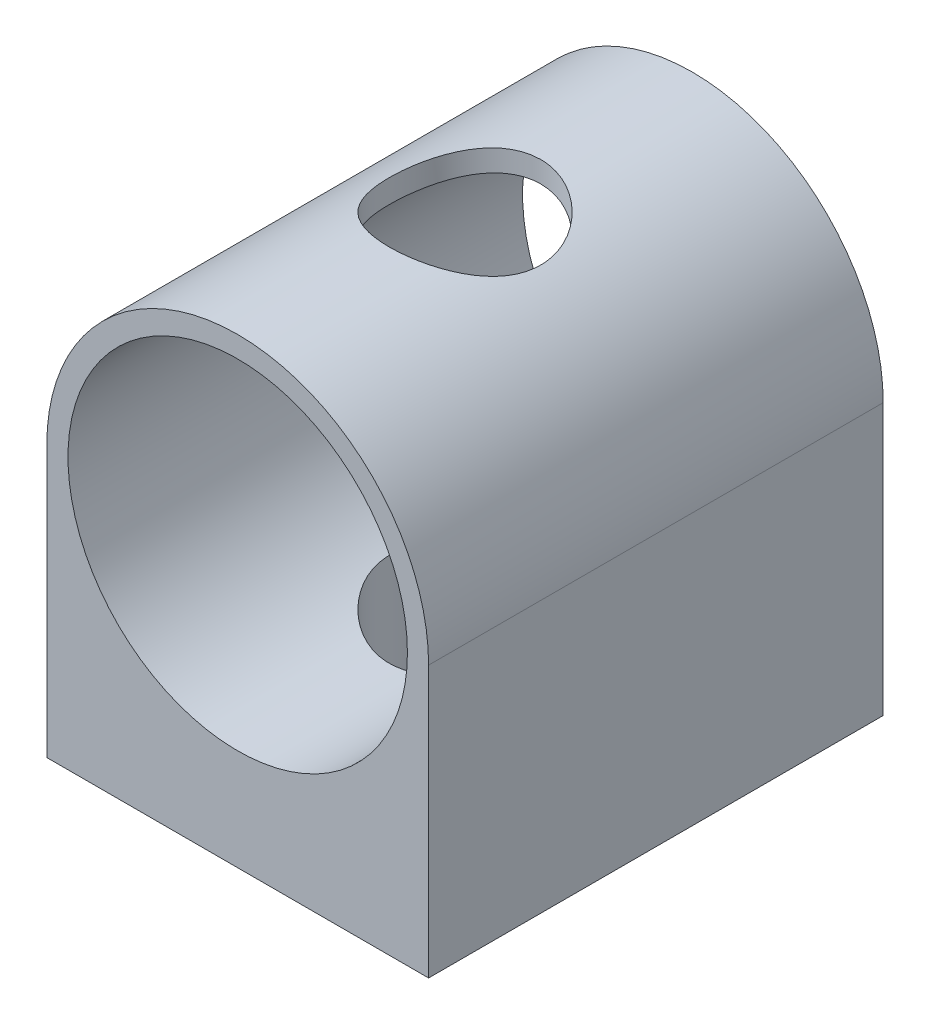
from build123d import *

# Parameters (mm, degrees)
SKETCH1_R           = 14.224
BOSS_EXTRUDE1_DEPTH = 38.1
SKETCH2_R           = 6.35
CUT_EXTRUDE1_DEPTH  = 57.621931547


with BuildPart() as part:
    # Sketch1 → Boss-Extrude1 (new body)
    with BuildSketch(Plane.XY):
        with BuildLine():
            Line((-16, 0), (16, 0))
            Line((16, 0), (16, 22.7096))
            ThreePointArc((16, 22.7096), (0, 38.7096), (-16, 22.7096))
            Line((-16, 22.7096), (-16, 0))
        make_face()
        with Locations((0, 22.7096)):
            Circle(SKETCH1_R, mode=Mode.SUBTRACT)
    extrude(amount=BOSS_EXTRUDE1_DEPTH)

    # Sketch2 → Cut-Extrude1 (cut, through all)
    with BuildSketch(Plane.XZ):
        with Locations((0, 19.05)):
            Circle(SKETCH2_R)
    extrude(amount=-CUT_EXTRUDE1_DEPTH, mode=Mode.SUBTRACT)


solid = part.part
